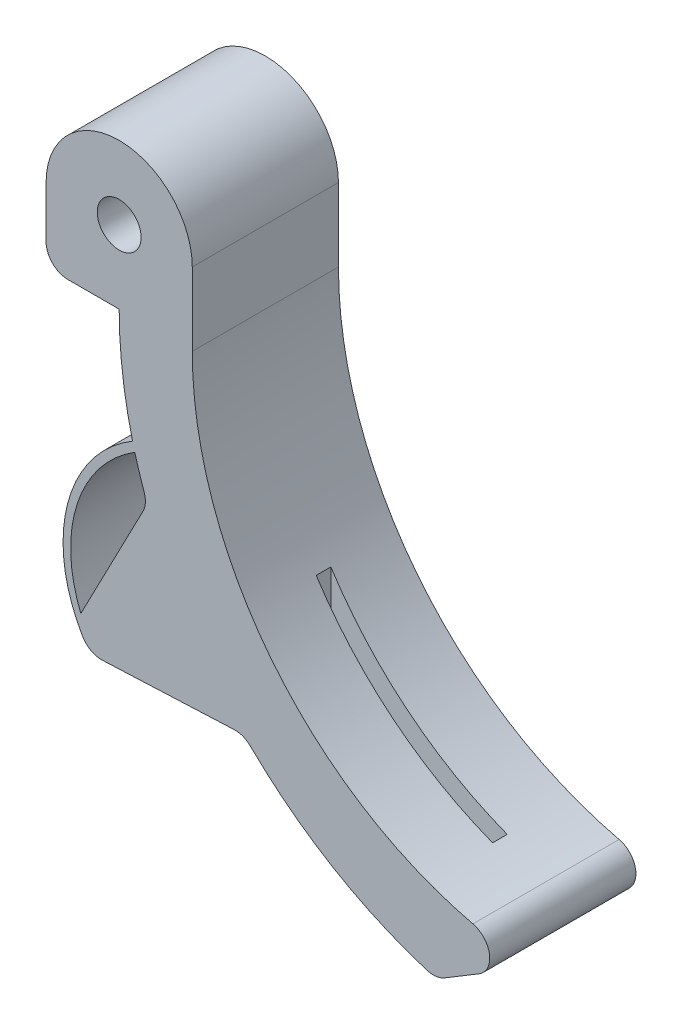
from build123d import *

# Parameters (mm, degrees)
SKETCH_2_R              = 1.5
EXTRUDE_1_DEPTH         = 10
FILLET_1_R              = 1.5
CUT_EXTRUDE_START       = 8.978636738
CUT_EXTRUDE_6_OUTLINE_W = 18
CUT_EXTRUDE_6_OUTLINE_H = 1
CUT_EXTRUDE_6_DEPTH     = 12.065744551
EXTRUDE_START           = -10
EXTRUDE_2_DEPTH         = 10


# Read off the part's stored shape, not the designer's step: 切除-拉伸6
with BuildPart() as part:
    # 草图2 → 凸台-拉伸1 (new body)
    with BuildSketch(Plane.XY):
        with BuildLine():
            Line((-3.738313135, -26.487804482), (8.522639585, -25.945713856))
            ThreePointArc((8.522639585, -25.945713856), (14.597644225, -30.744268797), (21.698305683, -33.828489568))
            Line((21.698305683, -33.828489568), (28.148131868, -29.931317342))
            ThreePointArc((28.148131868, -29.931317342), (11.679291726, -22.010339454), (5, -5))
            Line((5, -5), (5, 0))
            ThreePointArc((5, 0), (0, 5), (-5, 0))
            Line((-5, 0), (-5, -5))
            Line((-5, -5), (1.011e-06, -5))
            ThreePointArc((1.011e-06, -5), (0.486326168, -10.379869542), (1.929534162, -15.585314685))
            Line((1.929534162, -15.585314685), (-3.738313135, -26.487804482))
        make_face()
        Circle(SKETCH_2_R, mode=Mode.SUBTRACT)
    extrude(amount=EXTRUDE_1_DEPTH)

    # 圆角1
    fillet_1_edges = [part.edges().sort_by_distance(p)[0] for p in [
        (-3.738313135, -26.487804482, 5),
        (1.929534162, -15.585314685, 5),
        (-5, -5, 5),
        (28.148131868, -29.931317342, 5),
        (21.698305683, -33.828489568, 5),
        (8.522639585, -25.945713856, 5),
    ]]
    fillet(fillet_1_edges, radius=FILLET_1_R)

    # 切除-拉伸6 outline → 切除-拉伸6 (cut)
    with BuildSketch(Plane.YZ.offset(CUT_EXTRUDE_START)):
        with Locations((-26, 5)):
            Rectangle(CUT_EXTRUDE_6_OUTLINE_W, CUT_EXTRUDE_6_OUTLINE_H)
    extrude(amount=CUT_EXTRUDE_6_DEPTH, mode=Mode.SUBTRACT)

    # 草图3 → 凸台-拉伸2 (add)
    with BuildSketch(Plane.XY.offset(10).offset(EXTRUDE_START)):
        with BuildLine():
            Line((-2.473670042, -25.681158433), (-1.937795126, -25.681158433))
            ThreePointArc((-1.937795126, -25.681158433), (-3.071581107, -18.689223974), (1.070755407, -12.943471949))
            ThreePointArc((1.070755407, -12.943471949), (0.992362696, -12.652249172), (0.916901566, -12.360253041))
            ThreePointArc((0.916901566, -12.360253041), (-3.537234076, -18.318495365), (-2.473670042, -25.681158433))
        make_face()
    extrude(amount=EXTRUDE_2_DEPTH)


solid = part.part
